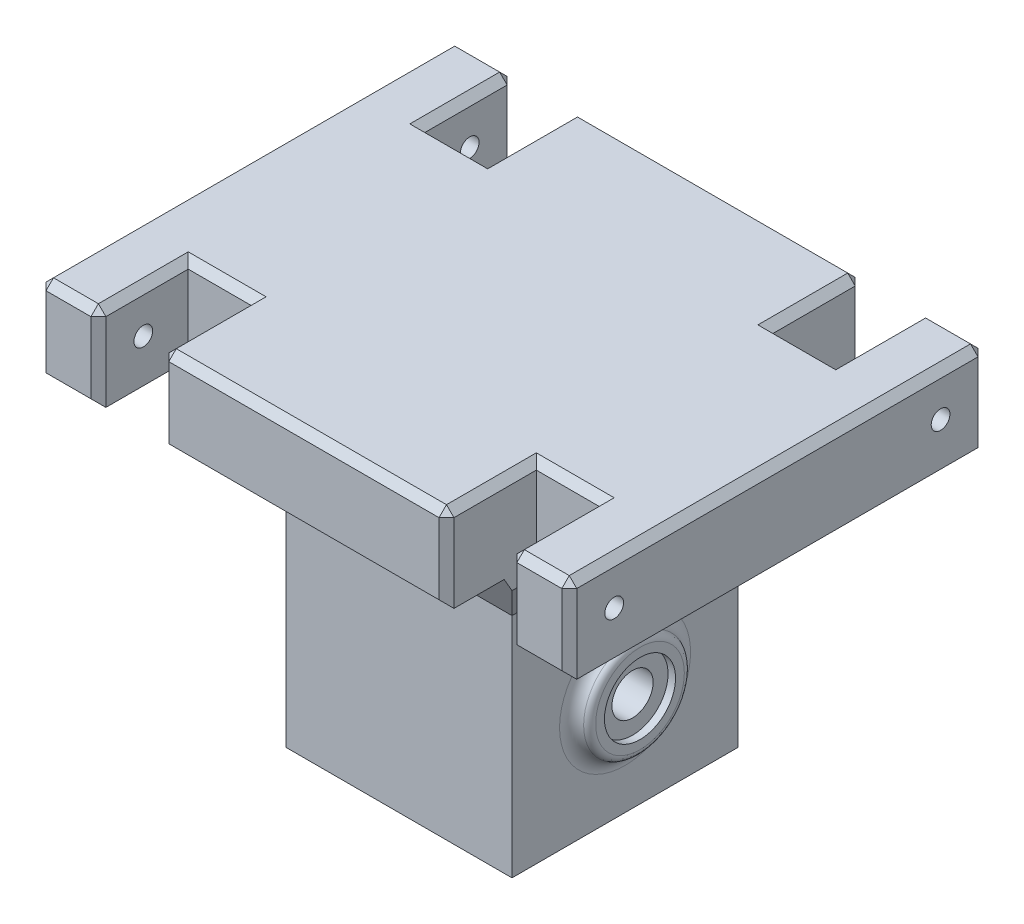
from build123d import *

# Parameters (mm, degrees)
BOSS_EXTRUDE1_DEPTH = 11.5
SKETCH2_W           = 30.2
SKETCH2_H           = 30.2
SKETCH2_W_2         = 20.2
SKETCH2_H_2         = 20.2
BOSS_EXTRUDE2_DEPTH = 40
SKETCH_S_R          = 2.75
CUT_EXTRUDE1_DEPTH  = 50
BOSS_EXTRUDE3_START = 1
SKETCH_S_3_R        = 4.75
SKETCH_S_3_R_2      = 2.75
BOSS_EXTRUDE3_DEPTH = 1
BOSS_EXTRUDE4_START = 2
SKETCH_S_4_R        = 6.75
SKETCH_S_4_R_2      = 4.75
BOSS_EXTRUDE4_DEPTH = 2
FILLET1_R           = 2
FILLET2_R           = 1
CHAMFER1_START      = -15.1
CHAMFER1_DEPTH      = 30.2
CHAMFER1_START_2    = -20.1
CHAMFER1_2_DEPTH    = 40.2
CHAMFER1_START_3    = -15.8
CHAMFER1_3_DEPTH    = 31.6
CHAMFER1_START_4    = -20
CHAMFER1_4_DEPTH    = 40
SKETCH3_R           = 1.25
CUT_EXTRUDE2_DEPTH  = 10
CHAMFER2_SIZE       = 1


with BuildPart() as part:
    # Sketch1 → Boss-Extrude1 (new body)
    with BuildSketch(Plane(origin=(0, 0, 0), x_dir=(1, 0, 0), z_dir=(0, 1, 0))):
        Polygon((27.45, 15.8), (19.05, 15.8), (19.05, 27.8), (-19.05, 27.8), (-19.05, 15.8), (-27.45, 15.8), (-27.45, 27.8), (-35.45, 27.8), (-35.45, -27.8), (-27.45, -27.8), (-27.45, -15.8), (-19.05, -15.8), (-19.05, -27.8), (19.05, -27.8), (19.05, -15.8), (27.45, -15.8), (27.45, -27.8), (35.45, -27.8), (35.45, 27.8), (27.45, 27.8), align=None)
    extrude(amount=BOSS_EXTRUDE1_DEPTH)

    # Sketch2 → Boss-Extrude2 (add)
    with BuildSketch(Plane.XZ):
        Rectangle(SKETCH2_W, SKETCH2_H)
        Rectangle(SKETCH2_W_2, SKETCH2_H_2, mode=Mode.SUBTRACT)
    extrude(amount=BOSS_EXTRUDE2_DEPTH)

    # s → Cut-Extrude1 (cut)
    with BuildSketch(Plane.ZY.offset(15.1)):
        with Locations((0, -24.8)):
            Circle(SKETCH_S_R)
    extrude(amount=-CUT_EXTRUDE1_DEPTH, mode=Mode.SUBTRACT)

    # s<3> → Boss-Extrude3 (add)
    with BuildSketch(Plane.ZY.offset(15.1).offset(BOSS_EXTRUDE3_START)):
        with Locations(Location((0, -24.8, 0), (0, 0, 180))):
            Circle(SKETCH_S_3_R)
        with Locations((0, -24.8)):
            Circle(SKETCH_S_3_R_2, mode=Mode.SUBTRACT)
    boss_extrude3 = extrude(amount=-BOSS_EXTRUDE3_DEPTH)

    # s<4> → Boss-Extrude4 (add)
    with BuildSketch(Plane.ZY.offset(15.1).offset(BOSS_EXTRUDE4_START)):
        with Locations(Location((0, -24.8, 0), (0, 0, 180))):
            Circle(SKETCH_S_4_R)
        with Locations((0, -24.8)):
            Circle(SKETCH_S_4_R_2, mode=Mode.SUBTRACT)
    boss_extrude4 = extrude(amount=-BOSS_EXTRUDE4_DEPTH)

    # Mirror3: Boss-Extrude3, Boss-Extrude4 across plane
    add(boss_extrude3.mirror(Plane(origin=(0, 0, 0), x_dir=(0, 0, 1), z_dir=(1, 0, 0))))
    add(boss_extrude4.mirror(Plane(origin=(0, 0, 0), x_dir=(0, 0, 1), z_dir=(1, 0, 0))))

    # Fillet1
    fillet1_edges = [part.edges().sort_by_distance(p)[0] for p in [
        (15.1, -24.8, 6.75),
        (-15.1, -24.8, 6.75),
    ]]
    fillet(fillet1_edges, radius=FILLET1_R - 0.0001)  # a hair under: the kernel refuses the full size

    # Fillet2
    fillet2_edges = [part.edges().sort_by_distance(p)[0] for p in [
        (17.1, -24.8, 6.75),
        (-17.1, -24.8, 6.75),
    ]]
    fillet(fillet2_edges, radius=FILLET2_R)

    # Chamfer1: read off the stored shape, not the designer's step
    # Chamfer1 outline → Chamfer1 (add)
    with BuildSketch(Plane.YZ.offset(CHAMFER1_START)):
        Polygon((0, 15.8), (0, 20.1), (-8.660254038, 15.1), (0, 15.1), align=None)
        Polygon((0, -15.8), (0, -15.1), (-8.660254038, -15.1), (0, -20.1), align=None)
    extrude(amount=CHAMFER1_DEPTH)

    # Chamfer1 2 outline → Chamfer1 2 (add)
    with BuildSketch(Plane.XY.offset(CHAMFER1_START_2)):
        Polygon((19.05, -1.818653348), (19.05, 0), (15.1, 0), (15.1, -8.660254038), align=None)
        Polygon((-15.1, -8.660254038), (-15.1, 0), (-19.05, 0), (-19.05, -1.818653348), align=None)
    extrude(amount=CHAMFER1_2_DEPTH)

    # Chamfer1 3 outline → Chamfer1 3 (add)
    with BuildSketch(Plane.XY.offset(CHAMFER1_START_3)):
        Polygon((20.1, 0), (19.05, 0), (19.05, -1.818653348), align=None)
        Polygon((-19.05, -1.818653348), (-19.05, 0), (-20.1, 0), align=None)
    extrude(amount=CHAMFER1_3_DEPTH)

    # Chamfer1 4 outline → Chamfer1 4 (cut)
    with BuildSketch(Plane.YZ.offset(CHAMFER1_START_4)):
        Polygon((-8.660254038, 15.1), (0, 20.1), (-8.660254038, 20.1), align=None)
        Polygon((-8.660254038, -20.1), (0, -20.1), (-8.660254038, -15.1), align=None)
    extrude(amount=CHAMFER1_4_DEPTH, mode=Mode.SUBTRACT)

    # Sketch3 → Cut-Extrude2 (cut)
    with BuildSketch(Plane(origin=(35.45, 0, 0), x_dir=(0, 0, -1), z_dir=(1, 0, 0))):
        with Locations((-21.8, 5.75)):
            Circle(SKETCH3_R)
        with Locations((21.8, 5.75)):
            Circle(SKETCH3_R)
    cut_extrude2 = extrude(amount=-CUT_EXTRUDE2_DEPTH, mode=Mode.SUBTRACT)

    # Mirror4: Cut-Extrude2 across plane
    add(cut_extrude2.mirror(Plane(origin=(0, 0, 0), x_dir=(0, 0, 1), z_dir=(1, 0, 0))), mode=Mode.SUBTRACT)

    # Chamfer2
    chamfer2_edges = [part.edges().sort_by_distance(p)[0] for p in [
        (31.45, 11.5, -27.8),
        (27.45, 11.5, -21.8),
        (0, 0, 27.8),
        (23.25, 11.5, -15.8),
        (-31.45, 0, 27.8),
        (-31.45, 0, -27.8),
        (19.05, 11.5, -21.8),
        (0, 0, -27.8),
        (31.45, 0, -27.8),
        (31.45, 0, 27.8),
        (0, 11.5, -27.8),
        (-19.05, 11.5, -21.8),
        (27.45, 5.75, 27.8),
        (19.05, 5.75, 27.8),
        (-19.05, 5.75, 27.8),
        (-27.45, 5.75, 27.8),
        (-35.45, 5.75, 27.8),
        (-35.45, 5.75, -27.8),
        (-27.45, 5.75, -27.8),
        (-23.25, 11.5, -15.8),
        (-19.05, 5.75, -27.8),
        (19.05, 5.75, -27.8),
        (27.45, 5.75, -27.8),
        (35.45, 5.75, -27.8),
        (35.45, 5.75, 27.8),
        (-27.45, 11.5, -21.8),
        (-31.45, 11.5, -27.8),
        (-35.45, 11.5, 0),
        (31.45, 11.5, 27.8),
        (-31.45, 11.5, 27.8),
        (-27.45, 11.5, 21.8),
        (-23.25, 11.5, 15.8),
        (-19.05, 11.5, 21.8),
        (15.1, -40, 0),
        (0, -40, 15.1),
        (-15.1, -40, 0),
        (0, -40, -15.1),
        (0, 11.5, 27.8),
        (10.1, -40, 0),
        (0, -40, 10.1),
        (-10.1, -40, 0),
        (0, -40, -10.1),
        (19.05, 11.5, 21.8),
        (23.25, 11.5, 15.8),
        (27.45, 11.5, 21.8),
        (35.45, 11.5, 0),
    ]]
    chamfer(chamfer2_edges, length=CHAMFER2_SIZE)


solid = part.part
